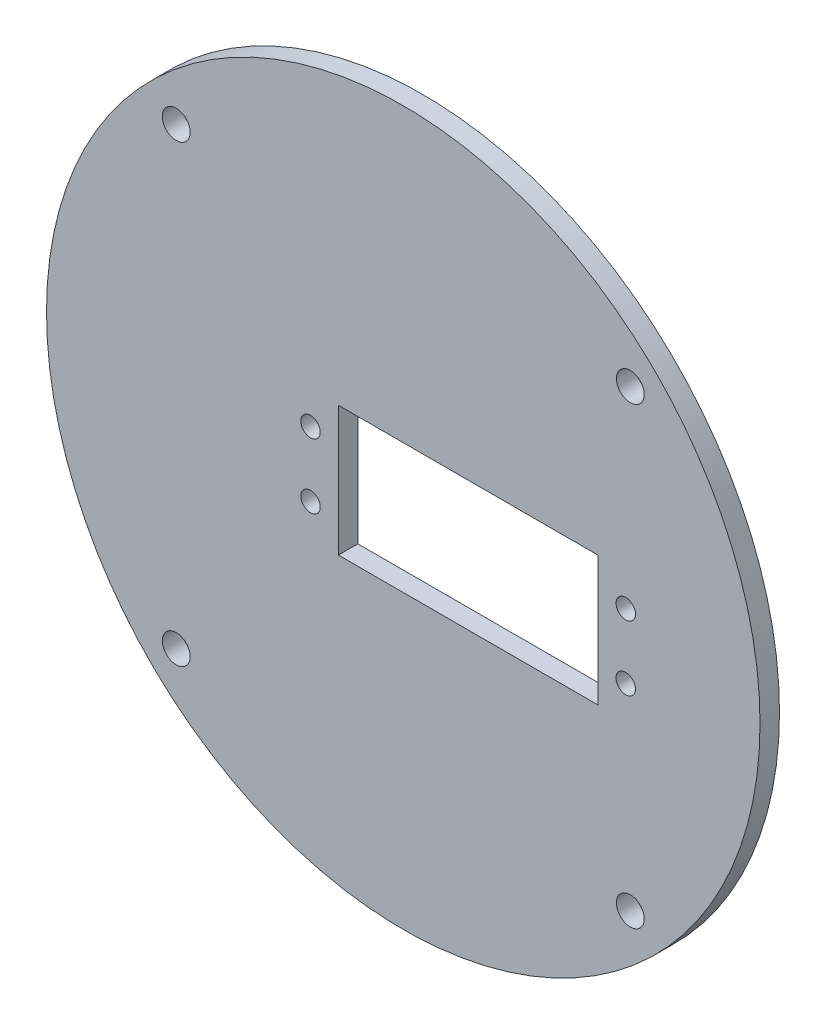
from build123d import *

# Parameters (mm, degrees)
SKETCH_1_R      = 55
SKETCH_1_R_2    = 2.15
SKETCH_1_R_3    = 1.5
SKETCH_1_W      = 40
SKETCH_1_H      = 20
EXTRUDE_2_DEPTH = 3


with BuildPart() as part:
    # 草图1 → 凸台-拉伸2 (new body)
    with BuildSketch(Plane.XY):
        Circle(SKETCH_1_R)
        with Locations((-35.001785669, -35.001785669)):
            Circle(SKETCH_1_R_2, mode=Mode.SUBTRACT)
        with Locations((35.001785669, -35.001785669)):
            Circle(SKETCH_1_R_2, mode=Mode.SUBTRACT)
        with Locations((35.001785669, 35.001785669)):
            Circle(SKETCH_1_R_2, mode=Mode.SUBTRACT)
        with Locations((-35.001785669, 35.001785669)):
            Circle(SKETCH_1_R_2, mode=Mode.SUBTRACT)
        with Locations((34.3, 5)):
            Circle(SKETCH_1_R_3, mode=Mode.SUBTRACT)
        with Locations((10, 0)):
            Rectangle(SKETCH_1_W, SKETCH_1_H, mode=Mode.SUBTRACT)
        with Locations((-14.3, 5)):
            Circle(SKETCH_1_R_3, mode=Mode.SUBTRACT)
        with Locations((-14.3, -5)):
            Circle(SKETCH_1_R_3, mode=Mode.SUBTRACT)
        with Locations((34.3, -5)):
            Circle(SKETCH_1_R_3, mode=Mode.SUBTRACT)
    extrude(amount=EXTRUDE_2_DEPTH)


solid = part.part
